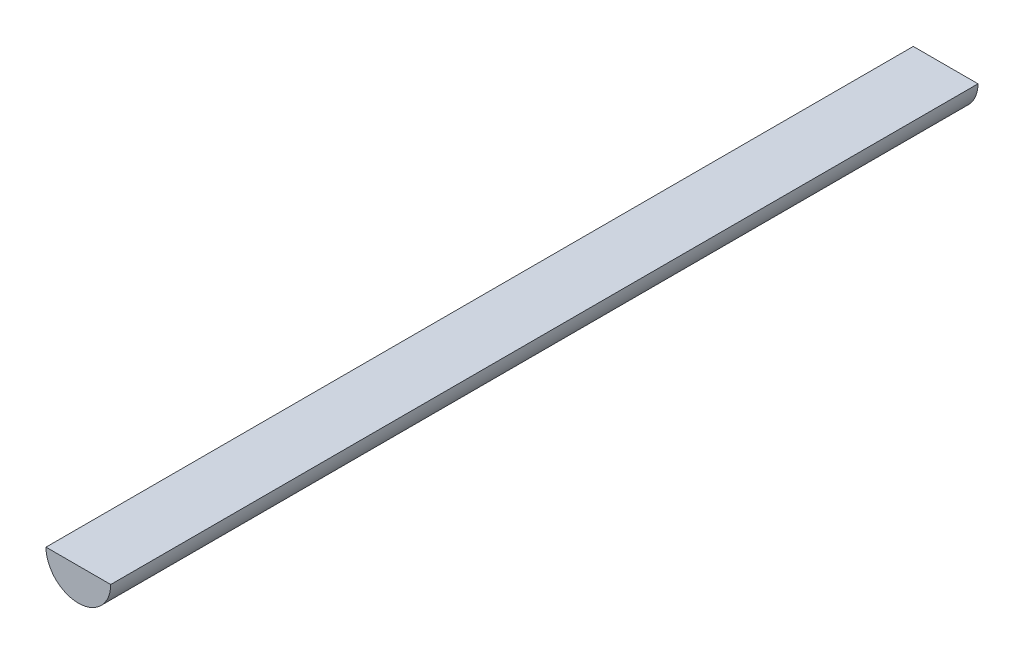
from build123d import *

# Parameters (mm, degrees)
BOSS_EXTRUDE1_DEPTH = 400
BOSS_EXTRUDE2_DEPTH = 1
BOSS_EXTRUDE3_START = 1
BOSS_EXTRUDE3_DEPTH = 1


with BuildPart() as part:
    # Sketch1 → Boss-Extrude1 (new body)
    with BuildSketch(Plane.XY):
        with BuildLine():
            Line((-15, 0), (15, 0))
            ThreePointArc((15, 0), (0, -15), (-15, 0))
        make_face()
        with BuildLine():
            Line((-13.964240044, -1), (13.964240044, -1))
            ThreePointArc((13.964240044, -1), (0, -14), (-13.964240044, -1))
        make_face(mode=Mode.SUBTRACT)
    extrude(amount=BOSS_EXTRUDE1_DEPTH)

    # Sketch2 → Boss-Extrude2 (add)
    with BuildSketch(Plane.XY.offset(400)):
        with BuildLine():
            Line((-15, 0), (15, 0))
            ThreePointArc((15, 0), (0, -15), (-15, 0))
        make_face()
    extrude(amount=BOSS_EXTRUDE2_DEPTH)

    # Sketch3 → Boss-Extrude3 (add)
    with BuildSketch(Plane(origin=(0, 0, 0), x_dir=(-1, 0, 0), z_dir=(0, 0, -1)).offset(BOSS_EXTRUDE3_START)):
        with BuildLine():
            Line((-15, 0), (15, 0))
            ThreePointArc((15, 0), (0, -15), (-15, 0))
        make_face()
    extrude(amount=-BOSS_EXTRUDE3_DEPTH)


solid = part.part
